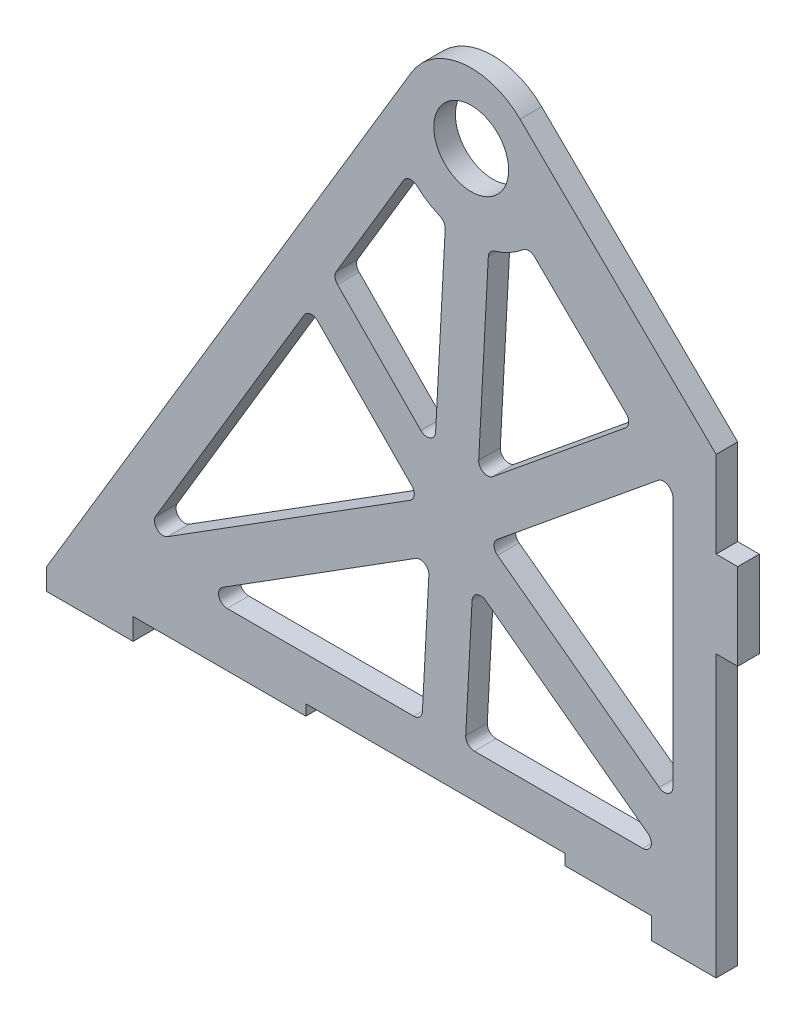
from build123d import *

# Parameters (mm, degrees)
SKETCH2_R           = 11
BOSS_EXTRUDE1_DEPTH = 6.35
CUT_EXTRUDE1_DEPTH  = 1781.261525592
FILLET1_R           = 2.54


with BuildPart() as part:
    # Sketch2 → Boss-Extrude1 (new body)
    with BuildSketch(Plane.XY):
        with BuildLine():
            Line((1592.072, 2.542062626), (1642.872, 2.542062626))
            Line((1642.872, 2.542062626), (1642.872, 5.717062626))
            Line((1642.872, 5.717062626), (1719.072, 5.717062626))
            Line((1719.072, 5.717062626), (1719.072, 2.542062626))
            Line((1719.072, 2.542062626), (1744.472, 2.542062626))
            Line((1744.472, 2.542062626), (1744.472, -3.807937374))
            Line((1744.472, -3.807937374), (1763.522, -3.807937374))
            Line((1763.522, -3.807937374), (1763.522, 78.742062626))
            Line((1763.522, 78.742062626), (1769.872, 78.742062626))
            Line((1769.872, 78.742062626), (1769.872, 104.142062626))
            Line((1769.872, 104.142062626), (1763.522, 104.142062626))
            Line((1763.522, 104.142062626), (1763.522, 129.542062626))
            Line((1763.522, 129.542062626), (1705.876596213, 186.076487834))
            ThreePointArc((1705.876596213, 186.076487834), (1688.880232851, 191.779061014), (1673.886428724, 181.951469947))
            Line((1673.886428724, 181.951469947), (1566.672, 2.542062626))
            Line((1566.672, 2.542062626), (1566.672, -3.807937374))
            Line((1566.672, -3.807937374), (1592.072, -3.807937374))
            Line((1592.072, -3.807937374), (1592.072, 2.542062626))
        make_face()
        with Locations((1691.505126, 171.422598626)):
            Circle(SKETCH2_R, mode=Mode.SUBTRACT)
    extrude(amount=BOSS_EXTRUDE1_DEPTH)

    # Sketch4 → Cut-Extrude1 (cut, through all)
    with BuildSketch(Plane.XY.offset(6.35)):
        with BuildLine():
            ThreePointArc((1683.953755863, 148.957808196), (1678.12887674, 151.858193301), (1673.312329252, 156.23338711))
            Line((1673.312329252, 156.23338711), (1650.793308757, 118.550734051))
            Line((1650.793308757, 118.550734051), (1680.724337509, 88.117212904))
            Line((1680.724337509, 88.117212904), (1683.953755863, 148.957808196))
        make_face()
        Polygon((1676.244439853, 74.560417264), (1644.060655462, 107.284514086), (1593.27487146, 22.301107315), align=None)
        with BuildLine():
            ThreePointArc((1708.425816584, 154.828014263), (1703.006027596, 150.700164829), (1696.635902547, 148.284639943))
            Line((1696.635902547, 148.284639943), (1693.404343424, 87.403713653))
            Line((1693.404343424, 87.403713653), (1739.080365406, 124.76425924))
            Line((1739.080365406, 124.76425924), (1708.425816584, 154.828014263))
        make_face()
        Polygon((1679.310561373, 61.482391308), (1610.937830527, 18.417062626), (1677.024654041, 18.417062626), align=None)
        Polygon((1750.822, 113.248916833), (1748.202242317, 115.818184894), (1696.6239735, 73.629916742), (1750.822, 33.34550852), align=None)
        Polygon((1692.015129519, 61.231631978), (1689.742532491, 18.417062626), (1749.617196094, 18.417062626), align=None)
    extrude(amount=-CUT_EXTRUDE1_DEPTH, mode=Mode.SUBTRACT)

    # Fillet1
    fillet1_edges = [part.edges().sort_by_distance(p)[0] for p in [
        (1673.312329252, 156.23338711, 3.175),
        (1593.27487146, 22.301107315, 3.175),
        (1708.425816584, 154.828014263, 3.175),
        (1750.822, 113.248916833, 3.175),
        (1748.202242317, 115.818184894, 3.175),
        (1750.822, 33.34550852, 3.175),
        (1696.6239735, 73.629916742, 3.175),
        (1739.080365406, 124.76425924, 3.175),
        (1693.404343424, 87.403713653, 3.175),
        (1696.635902547, 148.284639943, 3.175),
        (1677.024654041, 18.417062626, 3.175),
        (1610.937830527, 18.417062626, 3.175),
        (1679.310561373, 61.482391308, 3.175),
        (1644.060655462, 107.284514086, 3.175),
        (1676.244439853, 74.560417264, 3.175),
        (1683.953755863, 148.957808196, 3.175),
        (1650.793308757, 118.550734051, 3.175),
        (1749.617196094, 18.417062626, 3.175),
        (1689.742532491, 18.417062626, 3.175),
        (1692.015129519, 61.231631978, 3.175),
        (1680.724337509, 88.117212904, 3.175),
    ]]
    fillet(fillet1_edges, radius=FILLET1_R)


solid = part.part
